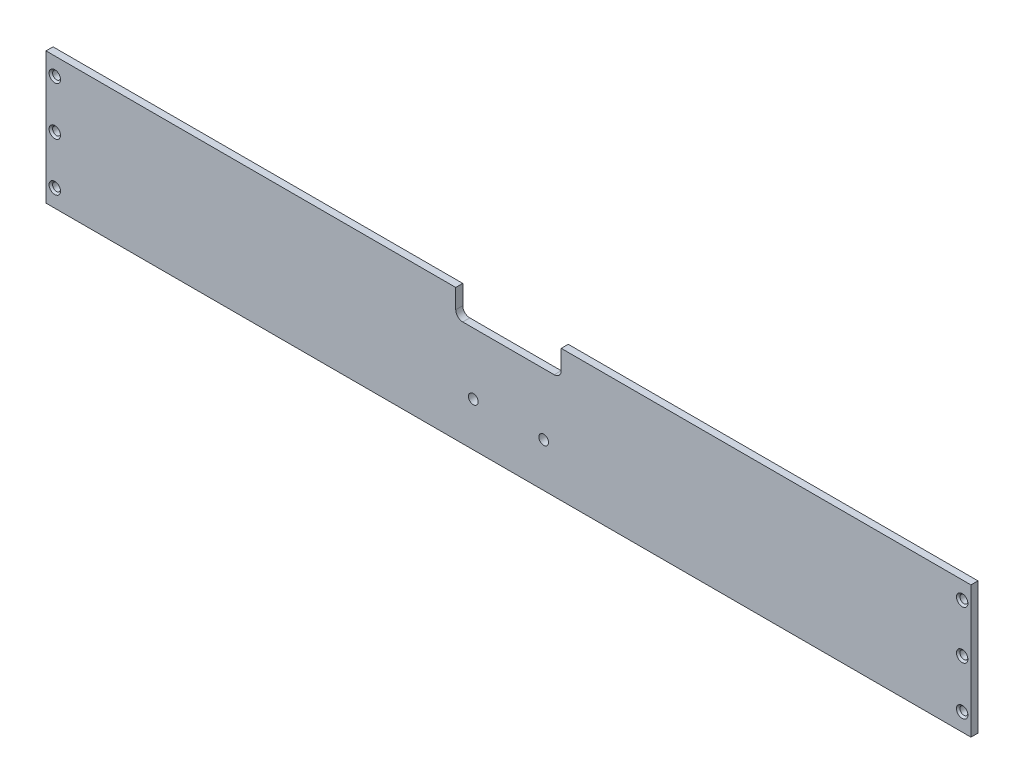
from build123d import *

# Parameters (mm, degrees)
SCHIZZO1_W                   = 526
SCHIZZO1_H                   = 75
ESTRUSIONE_ESTRUSIONE1_DEPTH = 4
TAGLIO_ESTRUSIONE1_DEPTH     = 4
SCHIZZO3_R                   = 2.75
SCHIZZO3_R_2                 = 2.25
TAGLIO_ESTRUSIONE2_DEPTH     = 532.335110829
SMUSSO1_SIZE                 = 1


with BuildPart() as part:
    # Schizzo1 → Estrusione-Estrusione1 (new body)
    with BuildSketch(Plane.XY):
        with Locations((263, 37.5)):
            Rectangle(SCHIZZO1_W, SCHIZZO1_H)
    extrude(amount=-ESTRUSIONE_ESTRUSIONE1_DEPTH)

    # Schizzo2 → Taglio-Estrusione1 (cut)
    with BuildSketch(Plane.XY):
        with BuildLine():
            Line((233, 90), (293, 90))
            Line((293, 90), (293, 64))
            ThreePointArc((293, 64), (291.828427125, 61.171572875), (289, 60))
            Line((289, 60), (237, 60))
            ThreePointArc((237, 60), (234.171572875, 61.171572875), (233, 64))
            Line((233, 64), (233, 90))
        make_face()
    extrude(amount=-TAGLIO_ESTRUSIONE1_DEPTH, mode=Mode.SUBTRACT)

    # Schizzo3 → Taglio-Estrusione2 (cut, through all)
    with BuildSketch(Plane.XY):
        with Locations((243, 25)):
            Circle(SCHIZZO3_R)
        with Locations((283, 25)):
            Circle(SCHIZZO3_R)
        with Locations((521, 65)):
            Circle(SCHIZZO3_R_2)
        with Locations((521, 37.5)):
            Circle(SCHIZZO3_R_2)
        with Locations((521, 10)):
            Circle(SCHIZZO3_R_2)
        with Locations((5, 10)):
            Circle(SCHIZZO3_R_2)
        with Locations((5, 37.5)):
            Circle(SCHIZZO3_R_2)
        with Locations((5, 65)):
            Circle(SCHIZZO3_R_2)
    extrude(amount=-TAGLIO_ESTRUSIONE2_DEPTH, mode=Mode.SUBTRACT)

    # Smusso1
    smusso1_edges = [part.edges().sort_by_distance(p)[0] for p in [
        (518.75, 37.5, 0),
        (518.75, 65, 0),
        (518.75, 10, 0),
        (2.75, 10, 0),
        (2.75, 37.5, 0),
        (2.75, 65, 0),
    ]]
    chamfer(smusso1_edges, length=SMUSSO1_SIZE)


solid = part.part
